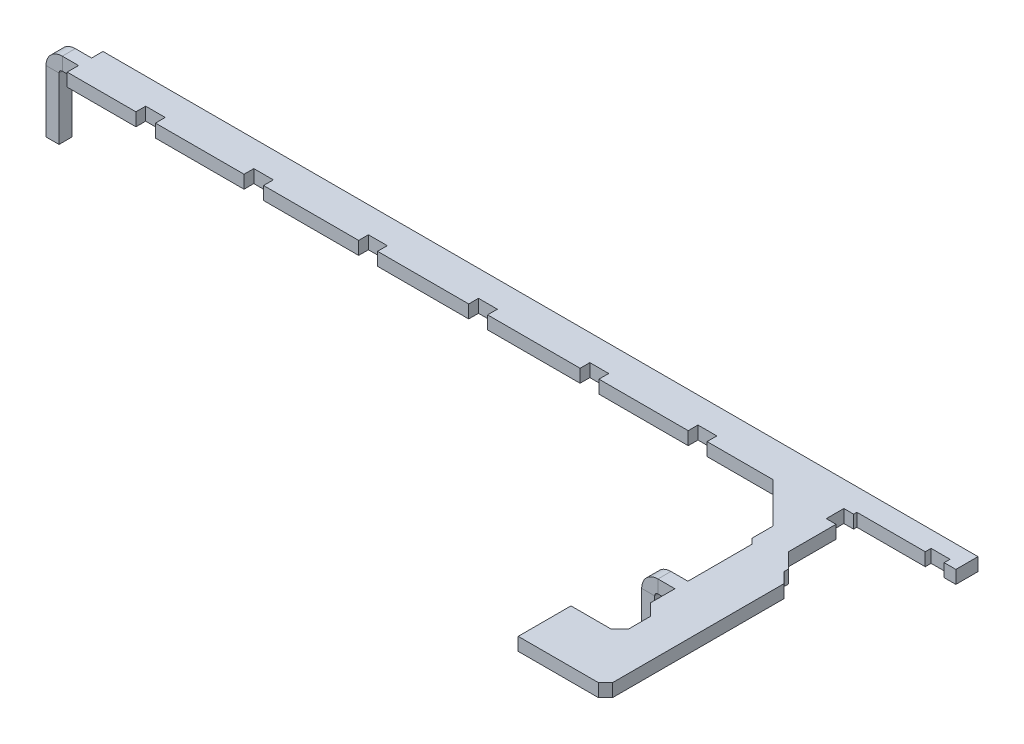
from build123d import *

# Parameters (mm, degrees)
BOSS_EXTRUDE1_DEPTH     = 2
EDGE_FLANGE1_DEPTH      = 2
EDGE_FLANGE1_BEND_DEPTH = 2
MOVE_FACE1_BY           = 5
CUT_EXTRUDE1_DEPTH      = 10


# Sheet-metal steps are written as plain solids
with BuildPart() as part:
    # Sketch1 → Boss-Extrude1 (new body)
    with BuildSketch(Plane(origin=(0, 0, 0), x_dir=(1, 0, 0), z_dir=(0, 1, 0))):
        Polygon((48.786990623, -23.171897133), (48.786990623, -13.328634875), (47.986992223, -12.528636475), (47.986992223, -9.428635055), (41.786991923, -3.228634755), (-54.913007717, -3.228634755), (-66.471417942, -3.228634755), (-66.471417942, -1.378635375), (-68.471417942, -1.378635375), (-68.471417942, 0.621364625), (-66.471417942, 0.621364625), (-66.471417942, 2.471364005), (-54.913007717, 2.471364005), (65.786992183, 2.471364005), (65.786992183, -1.128636415), (52.786992783, -1.128636415), (52.786992783, -11.528635935), (54.986990923, -13.728634075), (54.986993463, -14.428635215), (56.686992603, -16.128634355), (56.686992603, -42.528634895), (53.786993323, -45.428634175), (43.086991863, -45.428634175), (43.086991863, -34.028634115), (49.286992163, -34.028634115), (50.586992103, -32.728634175), (50.586992103, -30.828635435), (48.786990623, -29.028636495), (48.786990623, -25.171897133), (46.786990623, -25.171897133), (46.786990623, -23.171897133), align=None)
    extrude(amount=BOSS_EXTRUDE1_DEPTH)

    # Edge-Flange1 section (across the edge) → Edge-Flange1 (add)
    with BuildSketch(Plane(origin=(-69.471417942, 0, 1.378635375), x_dir=(1, 0, 0), z_dir=(0, 0, -1))):
        with BuildLine():
            Line((-2, 0.5), (-2, 10))
            Line((-2, 10), (0, 10))
            Line((0, 10), (0, 0.5))
            ThreePointArc((0, 0.5), (0.146446609, 0.146446609), (0.5, 0))
            Line((0.5, 0), (1, 0))
            Line((1, 0), (1, -2))
            Line((1, -2), (0.5, -2))
            ThreePointArc((0.5, -2), (-1.267766953, -1.267766953), (-2, 0.5))
        make_face()
    extrude(amount=EDGE_FLANGE1_DEPTH)

    # Edge-Flange1 section 2 (across the edge) → Edge-Flange1 bend (add)
    with BuildSketch(Plane(origin=(45.786990623, 0, 25.171897133), x_dir=(1, 0, 0), z_dir=(0, 0, -1))):
        with BuildLine():
            Line((-2, 0.5), (-2, 10))
            Line((-2, 10), (0, 10))
            Line((0, 10), (0, 0.5))
            ThreePointArc((0, 0.5), (0.146446609, 0.146446609), (0.5, 0))
            Line((0.5, 0), (1, 0))
            Line((1, 0), (1, -2))
            Line((1, -2), (0.5, -2))
            ThreePointArc((0.5, -2), (-1.267766953, -1.267766953), (-2, 0.5))
        make_face()
    extrude(amount=EDGE_FLANGE1_BEND_DEPTH)

    # Move Face1: a face moved outward by 5.0
    extrude(part.faces().sort_by_distance((65.786992183, 1, -0.671363795))[0], amount=MOVE_FACE1_BY, dir=(1, 0, 0))

    # Sketch12 → Cut-Extrude1 (cut)
    with BuildSketch(Plane(origin=(0, 2, 0), x_dir=(1, 0, 0), z_dir=(0, 1, 0))):
        Polygon((-52.913012042, -1.628639718), (-55.913012042, -1.628639718), (-55.913012042, -3.128639258), (-67.564249917, -3.128639258), (-67.671952829, -4.327104706), (41.886988858, -5.326407077), (48.086989158, -13.828640718), (48.007739716, -22.517187069), (46.286990623, -23.171897133), (48.886987558, -23.171897133), (48.886987558, -13.328639178), (48.086989158, -12.528640778), (48.086989158, -9.328639558), (41.886988858, -3.128639258), (31.786988738, -3.128639258), (31.786988738, -1.628639718), (28.886989458, -1.628639718), (28.886989458, -3.128639258), (15.186988918, -3.128639258), (15.186988918, -1.628639718), (12.286989638, -1.628639718), (12.286989638, -3.128639258), (-1.913012442, -3.128639258), (-1.913012442, -1.628639718), (-4.813011722, -1.628639718), (-4.813011722, -3.128639258), (-18.813011662, -3.128639258), (-18.813011662, -1.628639718), (-21.713010942, -1.628639718), (-21.713010942, -3.128639258), (-36.313012222, -3.128639258), (-36.313012222, -1.628639718), (-39.313011302, -1.628639718), (-39.313011302, -3.128639258), (-52.913012042, -3.128639258), align=None)
        Polygon((48.886987558, -25.171897133), (46.286990623, -25.171897133), (41.570815933, -34.028638418), (41.570815933, -47.167587605), (56.254650903, -46.954291818), (57.278434149, -42.02008581), (58.126913923, -16.761088184), (54.30540669, -8.580570975), (54.30540669, -2.3223377), (71.613193797, -2.589733287), (71.946410025, 3.760976012), (44.354427072, 3.760976012), (-68.474759816, 3.760976012), (-68.386329283, 2.371359902), (67.886988718, 2.371359902), (67.886988718, -1.028638378), (66.086988718, -1.028638378), (66.086988718, -0.128640178), (63.186989438, -0.128640178), (63.186989438, -1.028638378), (52.686987578, -1.028638378), (52.686987578, -1.528639918), (51.186988038, -1.528639918), (51.186988038, -4.228639598), (52.686987578, -4.228639598), (52.686987578, -11.528640238), (54.986988058, -13.828640718), (54.986988058, -14.528639318), (56.586989938, -16.128641198), (56.586989938, -42.428636858), (55.486987058, -43.528639738), (43.186988798, -43.528639738), (43.186988798, -35.428640698), (49.286986758, -35.428640698), (50.686989038, -34.028638418), (50.686989038, -30.728637398), (48.886987558, -28.928638458), align=None)
    extrude(amount=-CUT_EXTRUDE1_DEPTH, mode=Mode.SUBTRACT)


solid = part.part
